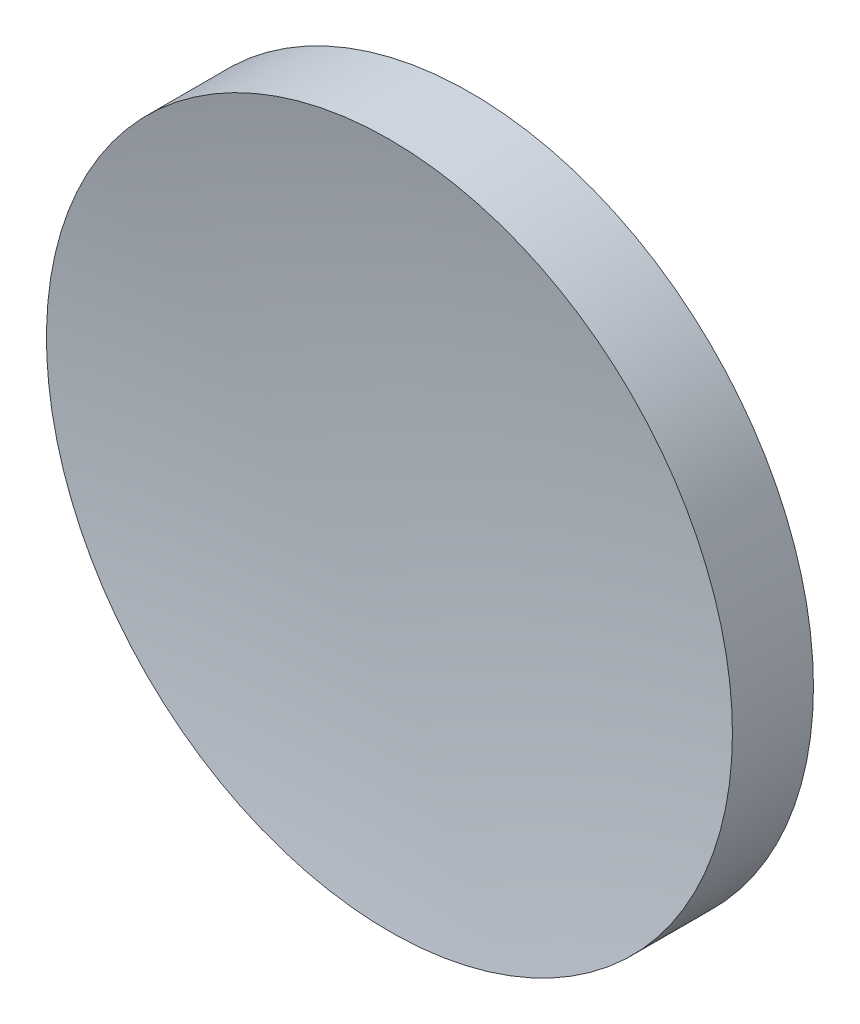
from build123d import *

# Parameters (mm, degrees)
SKETCH_1_R      = 12.7
EXTRUDE_1_DEPTH = 3


with BuildPart() as part:
    # 草图1 → 凸台-拉伸1 (new body)
    with BuildSketch(Plane.XY):
        Circle(SKETCH_1_R)
    extrude(amount=EXTRUDE_1_DEPTH)

    # 草图2 → 切除-旋转4 (revolve, cut)
    with BuildSketch(Plane(origin=(0, 0, 0), x_dir=(0, 0, -1), z_dir=(1, 0, 0))):
        with BuildLine():
            Line((-69.961558507, 0), (-1.806292256, 0))
            ThreePointArc((-1.806292256, 0), (-69.961558507, 68.155266251), (-138.116824758, 0))
            Line((-138.116824758, 0), (-69.961558507, 0))
        make_face()
    revolve(axis=Axis((0, 0, 1.806292256), (0, 0, -1)), mode=Mode.SUBTRACT)


solid = part.part
